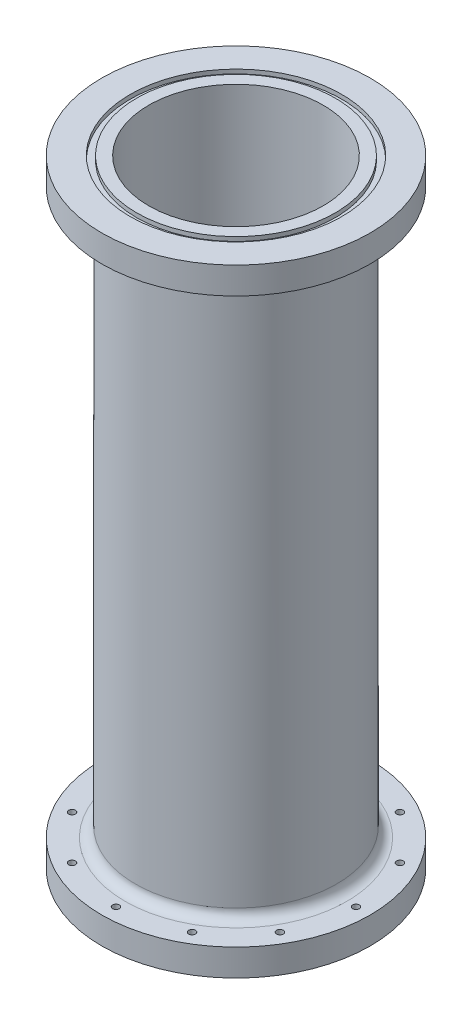
from build123d import *

# Parameters (mm, degrees)
SKETCH2_R                        = 47.625
SKETCH2_R_2                      = 41.275
BASE_CYLINDER_DEPTH              = 292.1
SKETCH3_R                        = 63.5
SKETCH3_R_2                      = 41.275
AFT_FLANGE_DEPTH                 = 12.7
FORWARD_START                    = -12.7
SKETCH4_R                        = 63.5
SKETCH4_R_2                      = 41.275
FORWARD_FLANGE_DEPTH             = 12.7
SKETCH6_R                        = 50.0761
SKETCH6_R_2                      = 47.0027
AFT_O_RING_DEPTH                 = 1.9812
FORWARD_START_2                  = -1.9812
SKETCH7_R                        = 50.0761
SKETCH7_R_2                      = 47.0027
FORWARD_O_RING_DEPTH             = 1.9812
F_1_8_0_125_DIAMETER_HOLE2_D     = 3.175
F_1_8_0_125_DIAMETER_HOLE2_DEPTH = 25.4
F_1_8_0_125_DIAMETER_HOLE2_TIP   = 0.953866233
FLANGE_FILLET_R                  = 4.7625


with BuildPart() as part:
    # Sketch2 → Base Cylinder (new body)
    with BuildSketch(Plane(origin=(0, 0, 0), x_dir=(1, 0, 0), z_dir=(0, 1, 0))):
        Circle(SKETCH2_R)
        Circle(SKETCH2_R_2, mode=Mode.SUBTRACT)
    extrude(amount=BASE_CYLINDER_DEPTH)

    # Sketch3 → Aft Flange (add)
    with BuildSketch(Plane.XZ):
        Circle(SKETCH3_R)
        Circle(SKETCH3_R_2, mode=Mode.SUBTRACT)
    extrude(amount=-AFT_FLANGE_DEPTH)

    # Sketch4 → Forward Flange (add)
    with BuildSketch(Plane(origin=(0, 292.1, 0), x_dir=(1, 0, 0), z_dir=(0, 1, 0)).offset(FORWARD_START)):
        Circle(SKETCH4_R)
        Circle(SKETCH4_R_2, mode=Mode.SUBTRACT)
    extrude(amount=FORWARD_FLANGE_DEPTH)

    # Sketch6 → Aft O-Ring (cut)
    with BuildSketch(Plane.XZ):
        Circle(SKETCH6_R)
        Circle(SKETCH6_R_2, mode=Mode.SUBTRACT)
    extrude(amount=-AFT_O_RING_DEPTH, mode=Mode.SUBTRACT)

    # Sketch7 → Forward O-Ring (cut)
    with BuildSketch(Plane(origin=(0, 292.1, 0), x_dir=(1, 0, 0), z_dir=(0, 1, 0)).offset(FORWARD_START_2)):
        Circle(SKETCH7_R)
        Circle(SKETCH7_R_2, mode=Mode.SUBTRACT)
    extrude(amount=FORWARD_O_RING_DEPTH, mode=Mode.SUBTRACT)

    # 1/8 (0.125) Diameter Hole2
    with Locations(Plane(origin=(0, 0, 0), x_dir=(-1, 0, 0), z_dir=(0, -1, 0))):
        with Locations((-28.3845, -49.163396147), (-49.163396147, -28.3845), (-56.769, 0), (-49.163396147, 28.3845), (-28.3845, 49.163396147), (0, 56.769), (28.3845, 49.163396147), (49.163396147, 28.3845), (56.769, 0), (49.163396147, -28.3845), (28.3845, -49.163396147), (0, -56.769)):
            Hole(F_1_8_0_125_DIAMETER_HOLE2_D / 2, depth=F_1_8_0_125_DIAMETER_HOLE2_DEPTH)
            with Locations((0, 0, -(F_1_8_0_125_DIAMETER_HOLE2_DEPTH + F_1_8_0_125_DIAMETER_HOLE2_TIP / 2))):  # 118° drill point
                Cone(0, F_1_8_0_125_DIAMETER_HOLE2_D / 2, F_1_8_0_125_DIAMETER_HOLE2_TIP, mode=Mode.SUBTRACT)

    # Flange Fillet
    flange_fillet_edges = [part.edges().sort_by_distance(p)[0] for p in [
        (-47.625, 12.7, 0),
        (-47.625, 279.4, 0),
    ]]
    fillet(flange_fillet_edges, radius=FLANGE_FILLET_R)


solid = part.part
